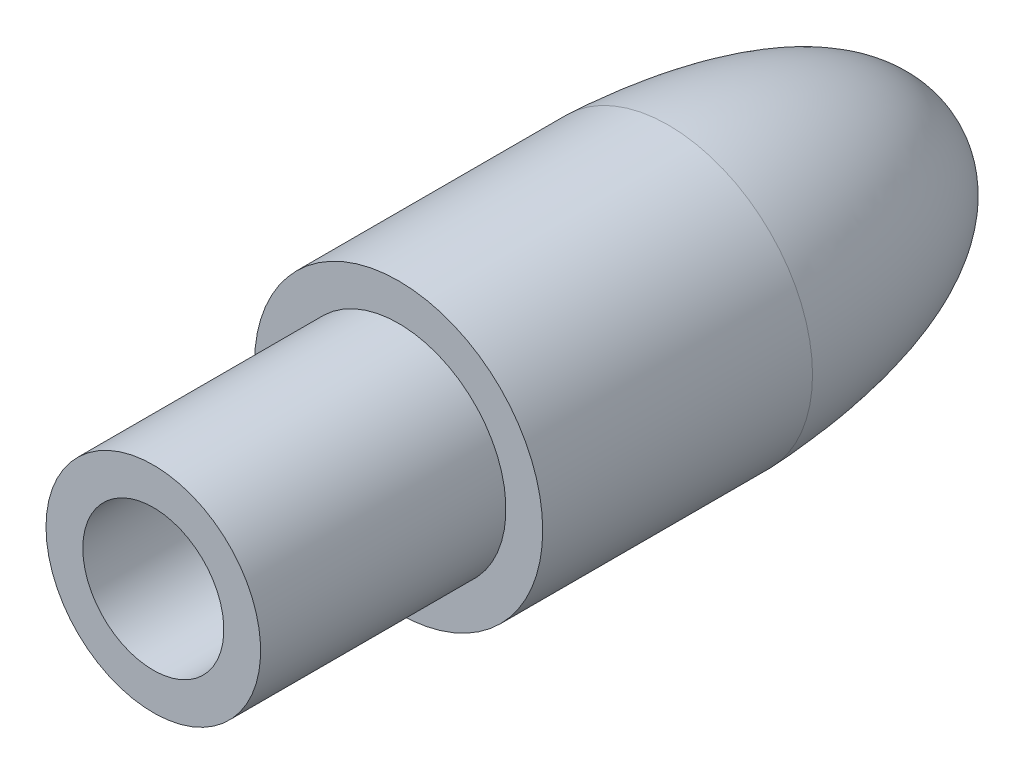
from build123d import *


with BuildPart() as part:
    # Sketch1 → Revolve1 (revolve)
    with BuildSketch(Plane(origin=(0, 0, 0), x_dir=(1, 0, 0), z_dir=(0, 1, 0))):
        with BuildLine():
            Line((0, 11.422413793), (0, 8.922413793))
            Line((0, 8.922413793), (-8.75, -10.577586207))
            Line((-8.75, -10.577586207), (-8.75, -29.577586207))
            Line((-8.75, -29.577586207), (-5.75, -29.577586207))
            Line((-5.75, -29.577586207), (-5.75, -52.577586207))
            Line((-5.75, -52.577586207), (-8.75, -52.577586207))
            Line((-8.75, -52.577586207), (-8.75, -32.577586207))
            Line((-8.75, -32.577586207), (-11.75, -32.577586207))
            Line((-11.75, -32.577586207), (-11.75, -10.577586207))
            add(Edge.make_bspline(
                [(0, 11.422413793), (-9.510806742, 11.041592385), (-11.379698938, -3.056352522), (-11.75, -10.577586207)],
                knots=[0, 0, 0, 0, 1, 1, 1, 1], degree=3))
        make_face()
    revolve(axis=Axis((0, 0, -11.422413793), (0, 0, 1)))


solid = part.part
